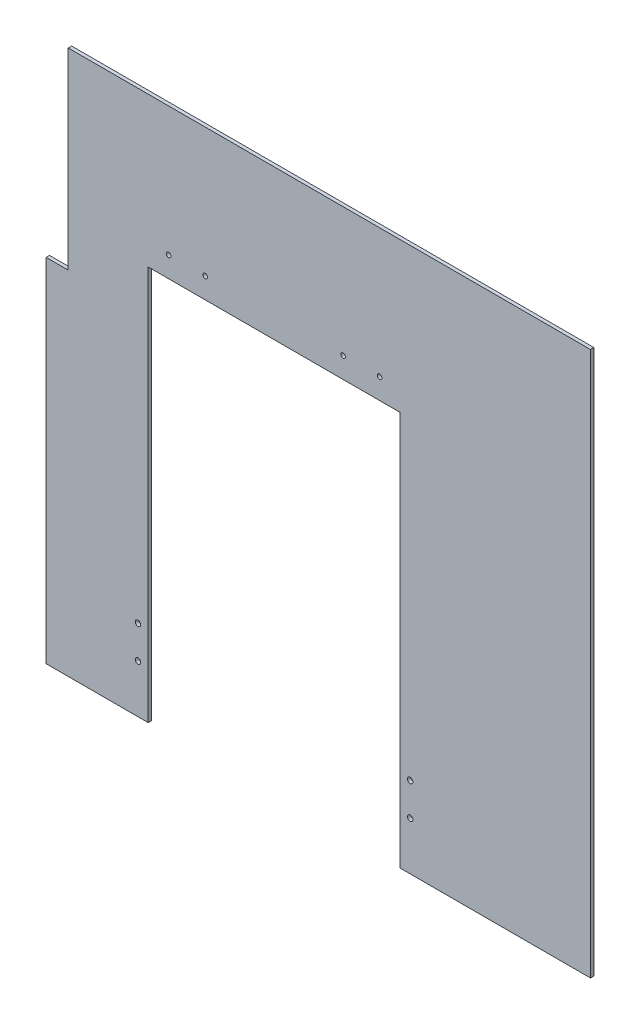
from build123d import *

# Parameters (mm, degrees)
SKETCH1_W           = 508
SKETCH1_H           = 508
BOSS_EXTRUDE1_DEPTH = 3.175
SKETCH2_R           = 2.54
SKETCH2_W           = 234.95
SKETCH2_H           = 368.3
CUT_EXTRUDE1_DEPTH  = 44.45
SKETCH4_R           = 2.159
CUT_EXTRUDE3_DEPTH  = 719.427505476


with BuildPart() as part:
    # Sketch1 → Boss-Extrude1 (new body)
    with BuildSketch(Plane.XY):
        with Locations((254, 254)):
            Rectangle(SKETCH1_W, SKETCH1_H)
    extrude(amount=BOSS_EXTRUDE1_DEPTH)

    # Sketch2 → Cut-Extrude1 (cut)
    with BuildSketch(Plane(origin=(0, 0, 0), x_dir=(-1, 0, 0), z_dir=(0, 0, -1))):
        with Locations((-339.725, 45.085)):
            Circle(SKETCH2_R)
        with Locations((-85.725, 45.085)):
            Circle(SKETCH2_R)
        with Locations((-339.725, 75.565)):
            Circle(SKETCH2_R)
        with Locations((-85.725, 75.565)):
            Circle(SKETCH2_R)
        with Locations((-212.725, 184.15)):
            Rectangle(SKETCH2_W, SKETCH2_H)
        Polygon((0, 403.06625), (0, 328.45375), (-20.6375, 328.45375), (-20.6375, 403.06625), (-20.6375, 508), (0, 508), align=None)
    extrude(amount=-CUT_EXTRUDE1_DEPTH, mode=Mode.SUBTRACT)

    # Sketch4 → Cut-Extrude3 (cut, through all)
    with BuildSketch(Plane(origin=(0, 0, 0), x_dir=(-1, 0, 0), z_dir=(0, 0, -1))):
        with Locations((-311.1754, 387.604)):
            Circle(SKETCH4_R)
        with Locations((-277.1394, 387.604)):
            Circle(SKETCH4_R)
        with Locations((-148.3614, 387.604)):
            Circle(SKETCH4_R)
        with Locations((-114.3254, 387.604)):
            Circle(SKETCH4_R)
    extrude(amount=-CUT_EXTRUDE3_DEPTH, mode=Mode.SUBTRACT)


solid = part.part
